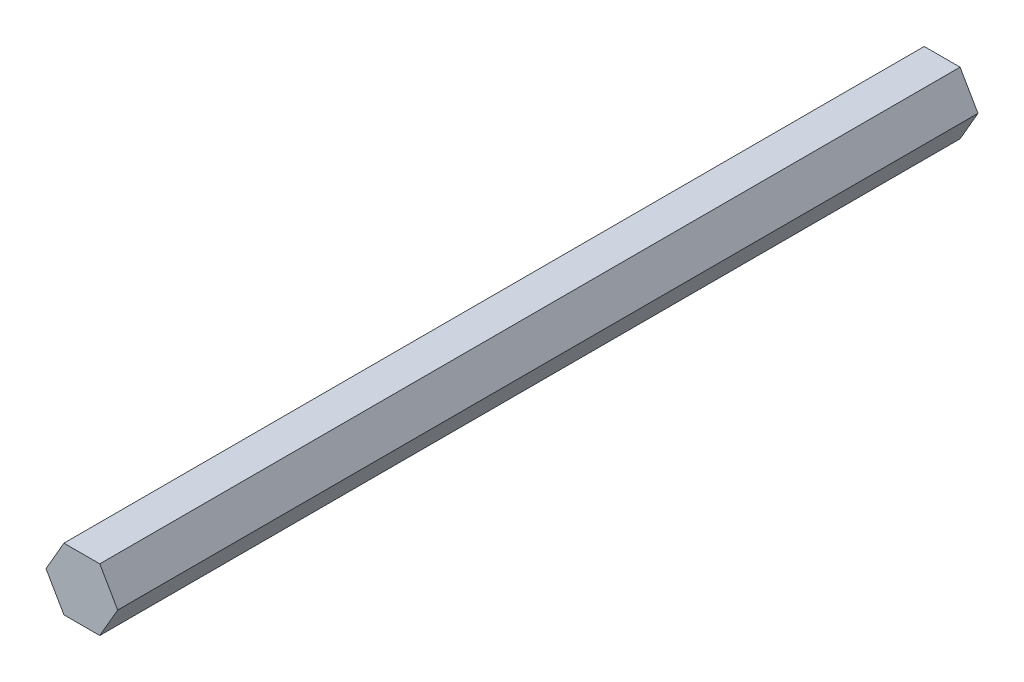
from build123d import *

# Parameters (mm, degrees)
BOSS_EXTRUDE1_DEPTH = 76.2


with BuildPart() as part:
    # Sketch1 → Boss-Extrude1 (new, symmetric)
    with BuildSketch(Plane.XY):
        Polygon((6.35, 0), (3.175, 5.499261314), (-3.175, 5.499261314), (-6.35, 0), (-3.175, -5.499261314), (3.175, -5.499261314), align=None)
    extrude(amount=BOSS_EXTRUDE1_DEPTH, both=True)


solid = part.part
